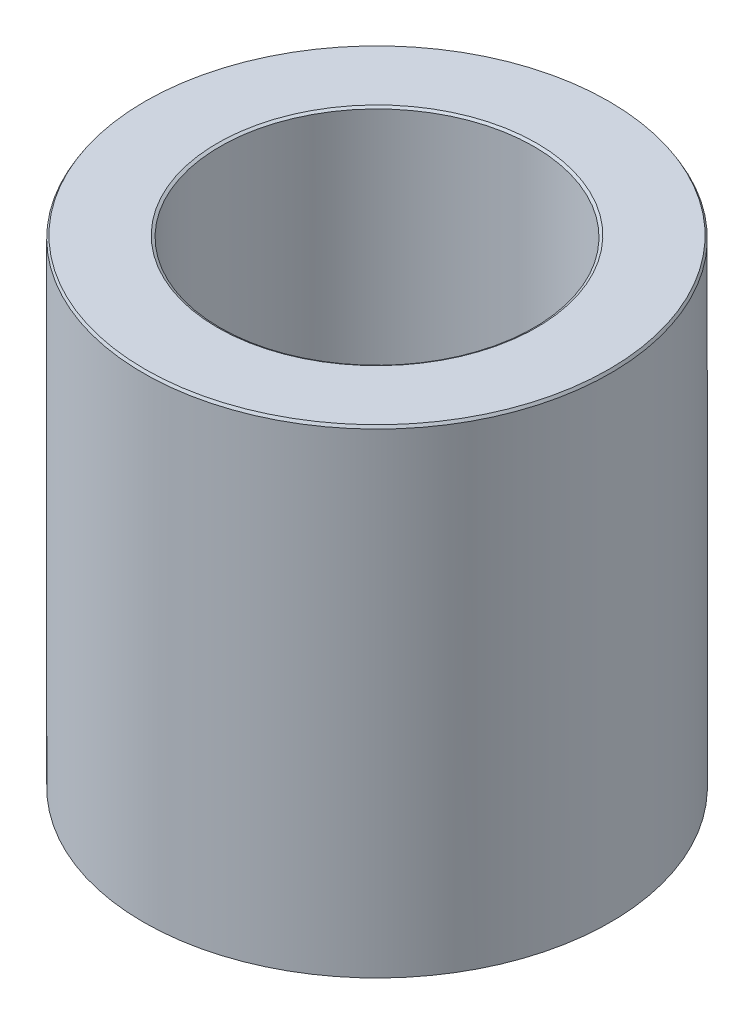
from build123d import *
from OCP.BRepFilletAPI import BRepFilletAPI_MakeChamfer

# Parameters (mm, degrees)
SKETCH1_R           = 30
BOSS_EXTRUDE1_DEPTH = 61.599672739
SKETCH2_R           = 20.162445174
CUT_EXTRUDE1_DEPTH  = 75.796521854
CHAMFER1_SIZE       = 0.343224064
CHAMFER1_SIZE2      = 0.202249419


with BuildPart() as part:
    # Sketch1 → Boss-Extrude1 (new body)
    with BuildSketch(Plane(origin=(0, 0, 0), x_dir=(1, 0, 0), z_dir=(0, 1, 0))):
        Circle(SKETCH1_R)
    extrude(amount=BOSS_EXTRUDE1_DEPTH)

    # Sketch2 → Cut-Extrude1 (cut, through all)
    with BuildSketch(Plane(origin=(0, 0, 0), x_dir=(1, 0, 0), z_dir=(0, 1, 0))):
        Circle(SKETCH2_R)
    extrude(amount=CUT_EXTRUDE1_DEPTH, mode=Mode.SUBTRACT)

    # Chamfer1: one chamfer whose edges measure the first distance from different faces: ONE call of the kernel's chamfer builder (chamfer() names one face for all edges)
    chamfer1_edges_1 = [part.edges().sort_by_distance(p)[0] for p in [
        (-20.162445174, 61.599672739, 0),
    ]]
    chamfer1_side_1 = [part.faces().sort_by_distance(p)[0] for p in [
        (-29.151471863, 61.599672739, 0),
    ]]
    chamfer1_edges_2 = [part.edges().sort_by_distance(p)[0] for p in [
        (-20.162445174, 0, 0),
    ]]
    chamfer1_side_2 = [part.faces().sort_by_distance(p)[0] for p in [
        (-20.162445174, 30.799836369, 0),
    ]]
    chamfer1_edges_3 = [part.edges().sort_by_distance(p)[0] for p in [
        (-30, 0, 0),
    ]]
    chamfer1_side_3 = [part.faces().sort_by_distance(p)[0] for p in [
        (-29.151471863, 0, 0),
    ]]
    chamfer1_edges_4 = [part.edges().sort_by_distance(p)[0] for p in [
        (-30, 61.599672739, 0),
    ]]
    chamfer1_side_4 = [part.faces().sort_by_distance(p)[0] for p in [
        (-30, 30.799836369, 0),
    ]]
    chamfer1 = BRepFilletAPI_MakeChamfer(part.part.solid().wrapped)
    for e in chamfer1_edges_1:
        chamfer1.Add(CHAMFER1_SIZE, CHAMFER1_SIZE2, e.wrapped, chamfer1_side_1[0].wrapped)  # the first distance lies on this face
    for e in chamfer1_edges_2:
        chamfer1.Add(CHAMFER1_SIZE, CHAMFER1_SIZE2, e.wrapped, chamfer1_side_2[0].wrapped)  # the first distance lies on this face
    for e in chamfer1_edges_3:
        chamfer1.Add(CHAMFER1_SIZE, CHAMFER1_SIZE2, e.wrapped, chamfer1_side_3[0].wrapped)  # the first distance lies on this face
    for e in chamfer1_edges_4:
        chamfer1.Add(CHAMFER1_SIZE, CHAMFER1_SIZE2, e.wrapped, chamfer1_side_4[0].wrapped)  # the first distance lies on this face
    add(Compound.cast(chamfer1.Shape()), mode=Mode.REPLACE)


solid = part.part
